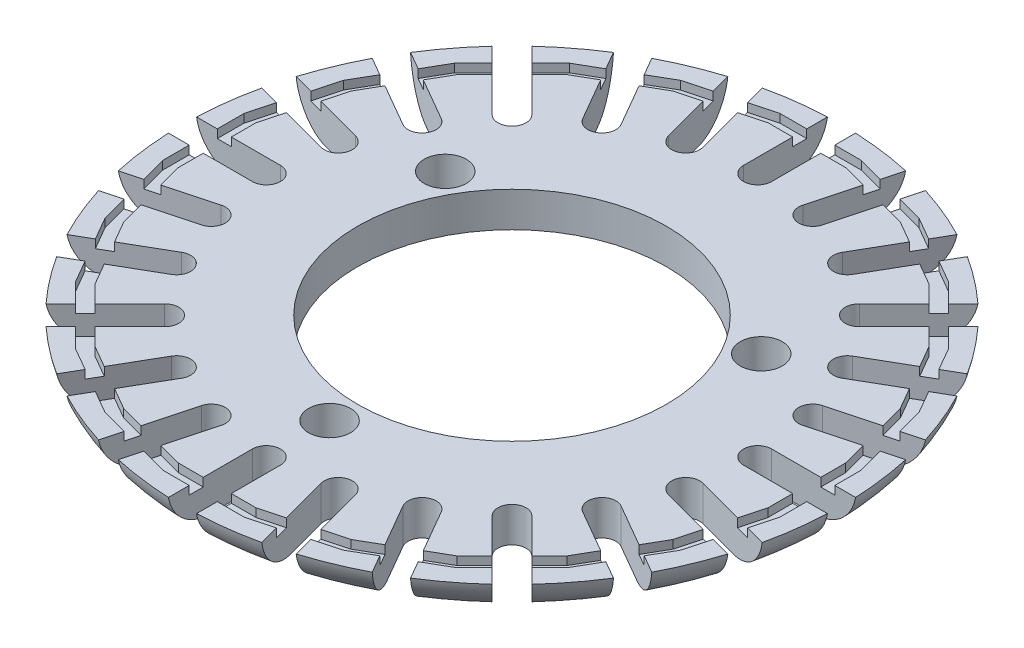
from build123d import *

# Parameters (mm, degrees)
ESBO_O1_R                = 23.5
RESSALTO_EXTRUS_O1_DEPTH = 2.5
FILETE1_R                = 3
CORTE_EXTRUS_O1_DEPTH    = 34.327916234
PADR_OCIRCULAR1_COUNT    = 24
CORTE_EXTRUS_O2_DEPTH    = 0.6
PADR_OCIRCULAR2_COUNT    = 24
ESBO_O5_R                = 11
CORTE_EXTRUS_O3_DEPTH    = 34.29789798
ESBO_O6_R                = 1.5
CORTE_EXTRUS_O5_DEPTH    = 2.5


with BuildPart() as part:
    # Esboço1 → Ressalto-extrusão1 (new body)
    with BuildSketch(Plane(origin=(0, 0, 0), x_dir=(1, 0, 0), z_dir=(0, 1, 0))):
        with Locations(Location((0, 0, 0), (0, 0, 270))):
            Circle(ESBO_O1_R)
    extrude(amount=RESSALTO_EXTRUS_O1_DEPTH)

    # Filete1
    # the kernel refuses this fillet: 3 mm, written as the material it takes off along each edge
    with BuildSketch(Plane(origin=(0, 0, 0), x_dir=(0, 0, 1), z_dir=(-1, 0, 0))) as filete1_piece_1:
        with BuildLine():
            CenterArc((20.541960108, 3), FILETE1_R, 270, 80.405931773)
            Line((20.541960108, 0), (20.541960108, -0.06))
            Line((20.541960108, -0.06), (23.5, -0.06))
            Line((23.5, -0.06), (23.56, 0))
            ThreePointArc((23.56, 0), (23.56, 1.25), (23.559160798, 2.49))
            Line((23.559160798, 2.49), (23.5, 2.5))
        make_face()
    revolve(axis=Axis((0, 0, 0), (0, 1, 0)), mode=Mode.SUBTRACT)

    # Esboço2 → Corte-extrusão1 (cut, through all)
    with BuildSketch(Plane(origin=(0, 2.5, 0), x_dir=(1, 0, 0), z_dir=(0, 1, 0))):
        with BuildLine():
            Line((1, 17.5), (1, 23.5))
            Line((1, 23.5), (-1, 23.5))
            Line((-1, 23.5), (-1, 17.5))
            ThreePointArc((-1, 17.5), (0, 16.5), (1, 17.5))
        make_face()
    corte_extrus_o1 = extrude(amount=-CORTE_EXTRUS_O1_DEPTH, mode=Mode.SUBTRACT)

    # PadrãoCircular1: Corte-extrusão1 ×24 about axis
    padr_ocircular1_axis = Axis((0, 0, 0), (0, 1, 0))
    for i in range(1, PADR_OCIRCULAR1_COUNT):
        add(corte_extrus_o1.rotate(padr_ocircular1_axis, i * 360 / PADR_OCIRCULAR1_COUNT), mode=Mode.SUBTRACT)

    # Esboço4 → Corte-extrusão2 (cut)
    with BuildSketch(Plane(origin=(0, 2.5, 0), x_dir=(1, 0, 0), z_dir=(0, 1, 0))):
        Polygon((-2.896354947, 22), (2.896354947, 22), (2.764702449, 21), (-2.764702449, 21), align=None)
    corte_extrus_o2 = extrude(amount=-CORTE_EXTRUS_O2_DEPTH, mode=Mode.SUBTRACT)

    # PadrãoCircular2: Corte-extrusão2 ×24 about axis
    padr_ocircular2_axis = Axis((0, 0, 0), (0, 1, 0))
    for i in range(1, PADR_OCIRCULAR2_COUNT):
        add(corte_extrus_o2.rotate(padr_ocircular2_axis, i * 360 / PADR_OCIRCULAR2_COUNT), mode=Mode.SUBTRACT)

    # Esboço5 → Corte-extrusão3 (cut, through all)
    with BuildSketch(Plane(origin=(0, 2.5, 0), x_dir=(1, 0, 0), z_dir=(0, 1, 0))):
        with Locations(Location((0, 0, 0), (0, 0, 270))):
            Circle(ESBO_O5_R)
    extrude(amount=-CORTE_EXTRUS_O3_DEPTH, mode=Mode.SUBTRACT)

    # Esboço6 → Corte-extrusão5 (cut)
    with BuildSketch(Plane(origin=(0, 2.5, 0), x_dir=(1, 0, 0), z_dir=(0, 1, 0))):
        with Locations(Location((-11.258330249, 6.5, 0), (0, 0, 270))):
            Circle(ESBO_O6_R)
        with Locations(Location((11.258330249, 6.5, 0), (0, 0, 270))):
            Circle(ESBO_O6_R)
        with Locations(Location((0, -13, 0), (0, 0, 270))):
            Circle(ESBO_O6_R)
    extrude(amount=-CORTE_EXTRUS_O5_DEPTH, mode=Mode.SUBTRACT)


solid = part.part
